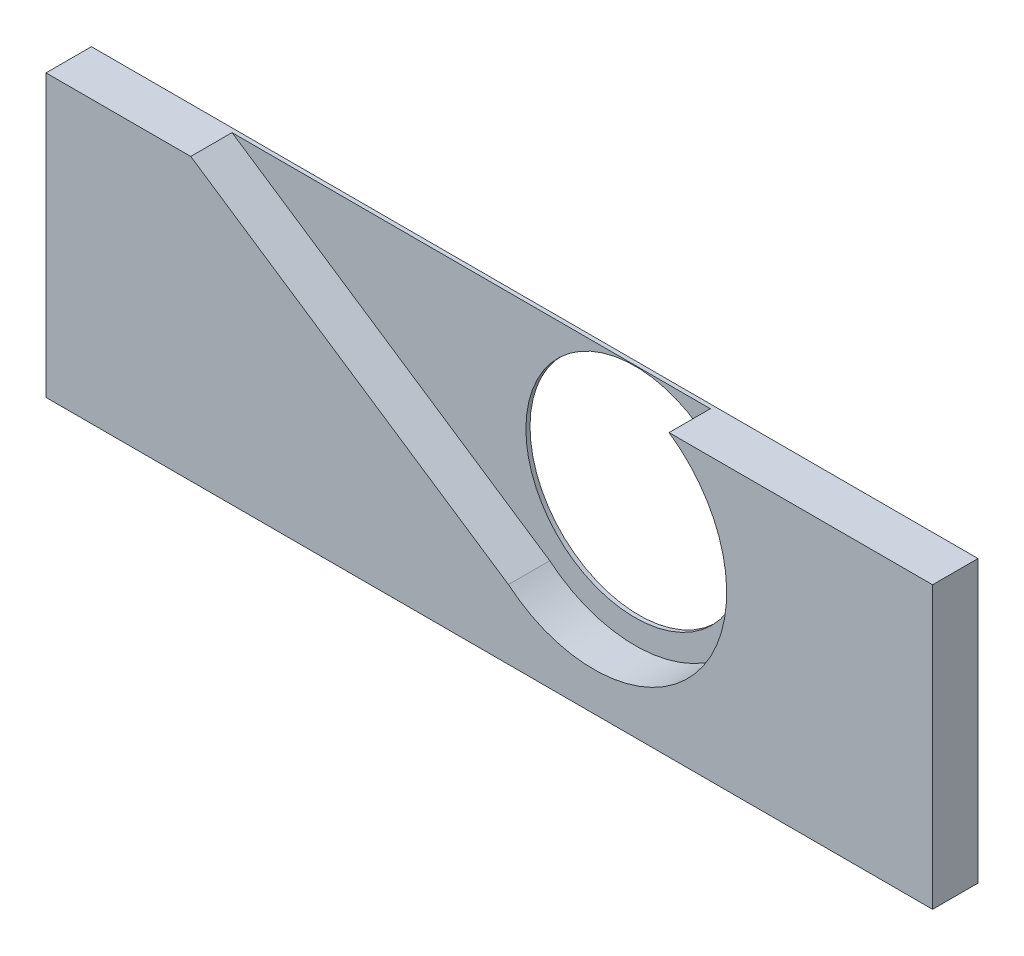
from build123d import *

# Parameters (mm, degrees)
SKETCH2_W           = 104.14
SKETCH2_H           = 33.02
BOSS_EXTRUDE1_DEPTH = 5.334
CAVITY1_START       = 0.4826
CAVITY1_DEPTH       = 4.8514
CAVITY1_2_OUTLINE_R = 12.8016
CAVITY1_2_DEPTH     = 0.4826


# Read off the part's stored shape, not the designer's step: Cavity1
with BuildPart() as part:
    # Sketch2 → Boss-Extrude1 (new body)
    with BuildSketch(Plane.XY):
        with Locations((52.07, 16.51)):
            Rectangle(SKETCH2_W, SKETCH2_H)
    extrude(amount=BOSS_EXTRUDE1_DEPTH)

    # Cavity1 outline → Cavity1 (cut)
    with BuildSketch(Plane.XY.offset(CAVITY1_START)):
        with BuildLine():
            Line((73.183671361, 33.02), (17.000497532, 33.02))
            Line((17.000497532, 33.02), (54.31426706, 8.129320565))
            ThreePointArc((54.31426706, 8.129320565), (76.777861535, 10.697572054), (73.183671361, 33.02))
        make_face()
    extrude(amount=CAVITY1_DEPTH, mode=Mode.SUBTRACT)

    # Cavity1 2 outline → Cavity1 2 (cut)
    with BuildSketch(Plane.XY):
        with Locations((64.319453414, 20.142181246)):
            Circle(CAVITY1_2_OUTLINE_R)
    extrude(amount=CAVITY1_2_DEPTH, mode=Mode.SUBTRACT)


solid = part.part
